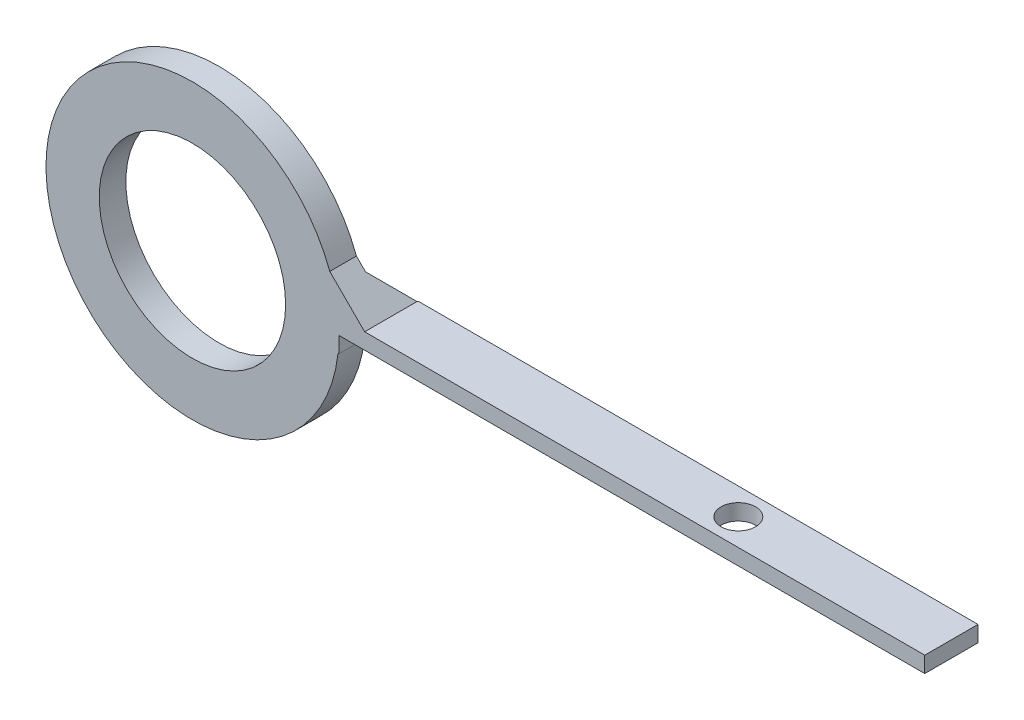
from build123d import *

# Parameters (mm, degrees)
SKETCH1_R           = 27.5
SKETCH1_R_2         = 17.5
BOSS_EXTRUDE1_DEPTH = 5
SKETCH2_W           = 120
SKETCH2_H           = 6
BOSS_EXTRUDE2_DEPTH = 10
SKETCH3_W           = 5
SKETCH3_H           = 3
CUT_EXTRUDE2_DEPTH  = 140
SKETCH4_W           = 5
SKETCH4_H           = 3
CUT_EXTRUDE3_DEPTH  = 10
CHAMFER2_SIZE       = 5
SKETCH5_W           = 5
SKETCH5_H           = 3
CUT_EXTRUDE4_DEPTH  = 110
CHAMFER3_SIZE       = 5
SKETCH6_R           = 3.25
CUT_EXTRUDE5_DEPTH  = 110


# Some blends are built 0.0001 mm under size
with BuildPart() as part:
    # Sketch1 → Boss-Extrude1 (new body)
    with BuildSketch(Plane.XY):
        Circle(SKETCH1_R)
        Circle(SKETCH1_R_2, mode=Mode.SUBTRACT)
    extrude(amount=BOSS_EXTRUDE1_DEPTH)

    # Sketch2 → Boss-Extrude2 (add)
    with BuildSketch(Plane.XY.offset(5)):
        with Locations((77.5, 0)):
            Rectangle(SKETCH2_W, SKETCH2_H)
    extrude(amount=-BOSS_EXTRUDE2_DEPTH)

    # Sketch3 → Cut-Extrude2 (cut)
    with BuildSketch(Plane.ZY.offset(-17.5)):
        with Locations((-2.5, -1.5)):
            Rectangle(SKETCH3_W, SKETCH3_H)
    extrude(amount=-CUT_EXTRUDE2_DEPTH, mode=Mode.SUBTRACT)

    # Sketch4 → Cut-Extrude3 (cut)
    with BuildSketch(Plane.ZY.offset(-17.5)):
        with Locations((-2.5, 1.5)):
            Rectangle(SKETCH4_W, SKETCH4_H)
    extrude(amount=-CUT_EXTRUDE3_DEPTH, mode=Mode.SUBTRACT)

    # Chamfer2
    chamfer2_edges = [part.edges().sort_by_distance(p)[0] for p in [
        (27.5, 1.5, -5),
    ]]
    chamfer(chamfer2_edges, length=CHAMFER2_SIZE - 0.0001)  # a hair under: the kernel refuses the full size

    # Sketch5 → Cut-Extrude4 (cut)
    with BuildSketch(Plane(origin=(137.5, 0, 0), x_dir=(0, 0, -1), z_dir=(1, 0, 0))):
        with Locations((-2.5, -1.5)):
            Rectangle(SKETCH5_W, SKETCH5_H)
    extrude(amount=-CUT_EXTRUDE4_DEPTH, mode=Mode.SUBTRACT)

    # Chamfer3
    # the kernel refuses this chamfer: 5.650095031, 5 mm, written as the material it adds along each edge
    with BuildSketch(Plane(origin=(27.335873866, 3, 5), x_dir=(1, 0, 0), z_dir=(0, 0, -1))) as chamfer3_piece_1_section:
        with BuildLine():
            Line((CHAMFER3_SIZE, 0), (-1.545806391, -6.545806391))
            ThreePointArc((-1.545806391, -6.545806391), (-0.594506403, -3.414769383), (0, 0))
            Line((0, 0), (CHAMFER3_SIZE, 0))
        make_face()
    chamfer3_piece_1 = extrude(amount=5, mode=Mode.PRIVATE)
    chamfer3_piece_1 = split(chamfer3_piece_1, bisect_by=Plane(origin=(27.5, 3, 5), z_dir=(1, 0, 0)), keep=Keep.TOP, mode=Mode.PRIVATE)
    add(chamfer3_piece_1)
    with BuildSketch(Plane(origin=(27.335873866, 3, 5), x_dir=(1, 0, 0), z_dir=(0, 0, -1))) as chamfer3_piece_2_section:
        with BuildLine():
            Line((CHAMFER3_SIZE, 0), (-1.545806391, -6.545806391))
            ThreePointArc((-1.545806391, -6.545806391), (-0.594506403, -3.414769383), (0, 0))
            Line((0, 0), (CHAMFER3_SIZE, 0))
        make_face()
    chamfer3_piece_2 = extrude(amount=5, mode=Mode.PRIVATE)
    chamfer3_piece_2 = split(chamfer3_piece_2, bisect_by=Plane(origin=(24.917886933, 3, 2.582013067), z_dir=(0.7071067811865478, 0, 0.7071067811865472)), keep=Keep.TOP, mode=Mode.PRIVATE)
    chamfer3_piece_2 = split(chamfer3_piece_2, bisect_by=Plane(origin=(27.5, 3, 5), z_dir=(-1, 0, 0)), keep=Keep.TOP, mode=Mode.PRIVATE)
    add(chamfer3_piece_2)
    with BuildSketch(Plane(origin=(27.335873866, 3, 5), x_dir=(1, 0, 0), z_dir=(0, 0, -1))) as chamfer3_piece_3_section:
        with BuildLine():
            Line((CHAMFER3_SIZE, 0), (-1.545806391, -6.545806391))
            ThreePointArc((-1.545806391, -6.545806391), (-0.594506403, -3.414769383), (0, 0))
            Line((0, 0), (CHAMFER3_SIZE, 0))
        make_face()
    chamfer3_piece_3 = extrude(amount=22.297831984, mode=Mode.PRIVATE)
    chamfer3_piece_3 = split(chamfer3_piece_3, bisect_by=Plane(origin=(24.917886933, 3, 2.582013067), z_dir=(0.7071067811865478, 0, 0.7071067811865472)), keep=Keep.TOP, mode=Mode.PRIVATE)
    chamfer3_piece_3 = split(chamfer3_piece_3, bisect_by=Plane(origin=(27.335873866, 3, 0), z_dir=(0, 0, -1)), keep=Keep.TOP, mode=Mode.PRIVATE)
    add(chamfer3_piece_3)
    with BuildSketch(Plane(origin=(27.335873866, 3, 5), x_dir=(1, 0, 0), z_dir=(0, 0, -1))) as chamfer3_piece_4_section:
        with BuildLine():
            Line((CHAMFER3_SIZE, 0), (-1.545806391, -6.545806391))
            ThreePointArc((-1.545806391, -6.545806391), (-0.594506403, -3.414769383), (0, 0))
            Line((0, 0), (CHAMFER3_SIZE, 0))
        make_face()
    chamfer3_piece_4 = extrude(amount=5, mode=Mode.PRIVATE)
    chamfer3_piece_4 = split(chamfer3_piece_4, bisect_by=Plane(origin=(24.917886933, 3, 2.582013067), z_dir=(-0.7071067811865478, 0, -0.7071067811865472)), keep=Keep.TOP, mode=Mode.PRIVATE)
    add(chamfer3_piece_4)

    # Sketch6 → Cut-Extrude5 (cut)
    with BuildSketch(Plane.XZ):
        with Locations(Location((97.5, 0, 0), (0, 0, 270))):
            Circle(SKETCH6_R)
    extrude(amount=-CUT_EXTRUDE5_DEPTH, mode=Mode.SUBTRACT)


solid = part.part
